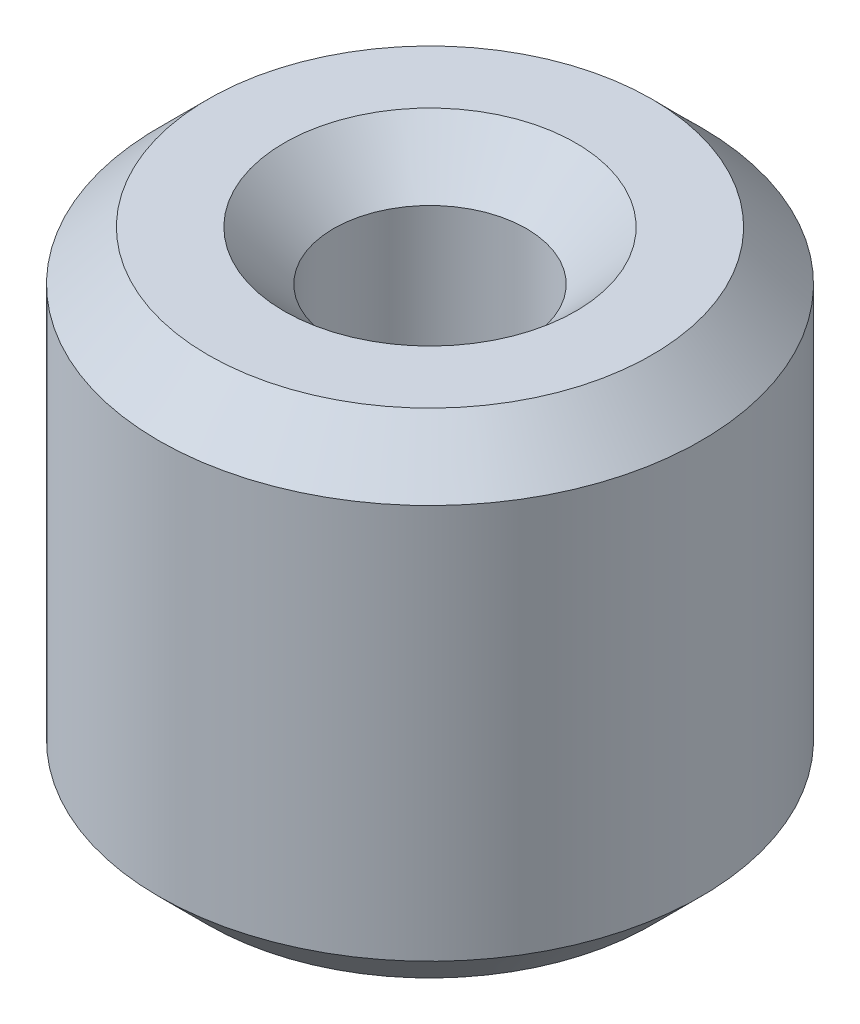
from build123d import *

# Parameters (mm, degrees)
SKETCH1_R           = 15
BOSS_EXTRUDE1_DEPTH = 27.29711355
SKETCH2_R           = 5.329339644
CUT_EXTRUDE1_DEPTH  = 35.570687123
CHAMFER1_SIZE       = 2.733954723


with BuildPart() as part:
    # Sketch1 → Boss-Extrude1 (new body)
    with BuildSketch(Plane(origin=(0, 0, 0), x_dir=(1, 0, 0), z_dir=(0, 1, 0))):
        Circle(SKETCH1_R)
    extrude(amount=BOSS_EXTRUDE1_DEPTH)

    # Sketch2 → Cut-Extrude1 (cut, through all)
    with BuildSketch(Plane(origin=(0, 0, 0), x_dir=(1, 0, 0), z_dir=(0, 1, 0))):
        Circle(SKETCH2_R)
    extrude(amount=CUT_EXTRUDE1_DEPTH, mode=Mode.SUBTRACT)

    # Chamfer1
    chamfer1_edges = [part.edges().sort_by_distance(p)[0] for p in [
        (-5.329339644, 27.29711355, 0),
        (-5.329339644, 0, 0),
        (-15, 0, 0),
        (-15, 27.29711355, 0),
    ]]
    chamfer(chamfer1_edges, length=CHAMFER1_SIZE)


solid = part.part
